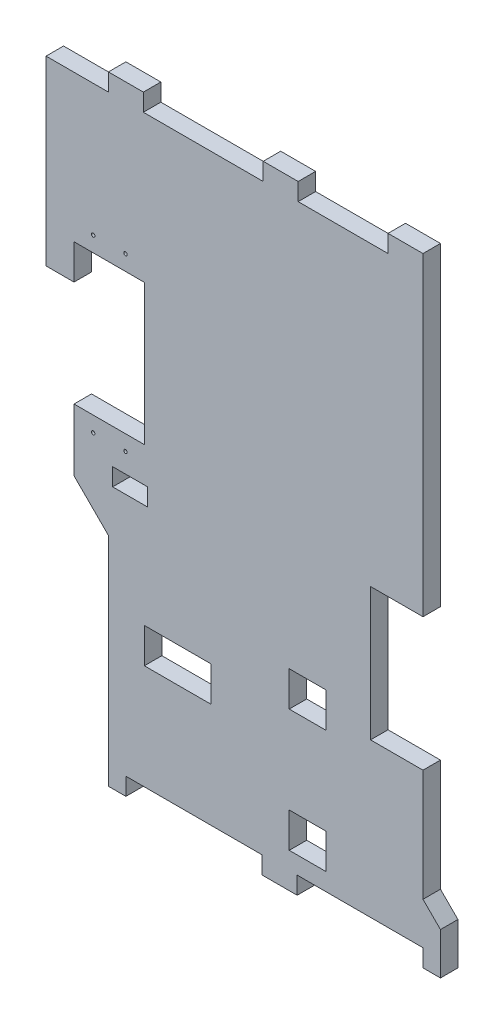
from build123d import *

# Parameters (mm, degrees)
ESQUISSE1_W             = 10.465871206
ESQUISSE1_H             = 10
ESQUISSE1_W_2           = 19.015615649
BOSS_EXTRU_1_DEPTH      = 5
BOSS_EXTRU_2_DEPTH      = 5
ESQUISSE3_R             = 0.5
ESQUISSE3_W             = 20.2
ESQUISSE3_H             = 40.2
ENL_V_MAT_EXTRU_1_DEPTH = 5
ESQUISSE4_W             = 10
ESQUISSE4_H             = 5
BOSS_EXTRU_3_DEPTH      = 5
ESQUISSE5_W             = 10
ESQUISSE5_H             = 5.002990156
ENL_V_MAT_EXTRU_2_DEPTH = 10


with BuildPart() as part:
    # Esquisse1 → Boss.-Extru.1 (new body)
    with BuildSketch(Plane.XY):
        Polygon((90, 82), (90, 167), (90, 172), (80, 172), (80, 167), (10, 167), (10, 172), (0, 172), (0, 167), (0, 0), (0, -5), (5, -5), (5, 0), (90, 0), (90, 44), (75, 44), (75, 82), align=None)
        with Locations((56.967345119, 45)):
            Rectangle(ESQUISSE1_W, ESQUISSE1_H, mode=Mode.SUBTRACT)
        with Locations((56.967345119, 10)):
            Rectangle(ESQUISSE1_W, ESQUISSE1_H, mode=Mode.SUBTRACT)
        with Locations((19.799482129, 35)):
            Rectangle(ESQUISSE1_W_2, ESQUISSE1_H, mode=Mode.SUBTRACT)
    extrude(amount=BOSS_EXTRU_1_DEPTH)

    # Esquisse2 → Boss.-Extru.2 (add)
    with BuildSketch(Plane.XY.offset(5)):
        Polygon((0, 167), (-9.834708684, 167), (-9.834708684, 67), (0, 57.165291316), align=None)
    extrude(amount=-BOSS_EXTRU_2_DEPTH)

    # Esquisse3 → Enlèv. mat.-Extru.1 (cut)
    with BuildSketch(Plane(origin=(0, 0, 0), x_dir=(-1, 0, 0), z_dir=(0, 0, -1))):
        with Locations((4.359708684, 129.4)):
            Circle(ESQUISSE3_R)
        with Locations((-4.890291316, 129.4)):
            Circle(ESQUISSE3_R)
        with Locations((4.359708684, 80.4)):
            Circle(ESQUISSE3_R)
        with Locations((-4.890291316, 80.4)):
            Circle(ESQUISSE3_R)
        with Locations((-0.265291316, 104.9)):
            Rectangle(ESQUISSE3_W, ESQUISSE3_H)
    extrude(amount=-ENL_V_MAT_EXTRU_1_DEPTH, mode=Mode.SUBTRACT)

    # Esquisse4 → Boss.-Extru.3 (add)
    with BuildSketch(Plane.XY.offset(5)):
        Polygon((-9.834708684, 167), (-17.834708684, 167), (-17.834708684, 115), (-9.834708684, 115), (-9.834708684, 125), align=None)
        with Locations((49, -2.5)):
            Rectangle(ESQUISSE4_W, ESQUISSE4_H)
        Polygon((90, 12), (95, 7), (95, -5), (90, -5), align=None)
        with Locations((49.28893367, 169.5)):
            Rectangle(ESQUISSE4_W, ESQUISSE4_H)
    extrude(amount=-BOSS_EXTRU_3_DEPTH)

    # Esquisse5 → Enlèv. mat.-Extru.2 (cut)
    with BuildSketch(Plane.XY.offset(5)):
        with Locations((6.220251404, 72.298504922)):
            Rectangle(ESQUISSE5_W, ESQUISSE5_H)
    extrude(amount=-ENL_V_MAT_EXTRU_2_DEPTH, mode=Mode.SUBTRACT)


solid = part.part
